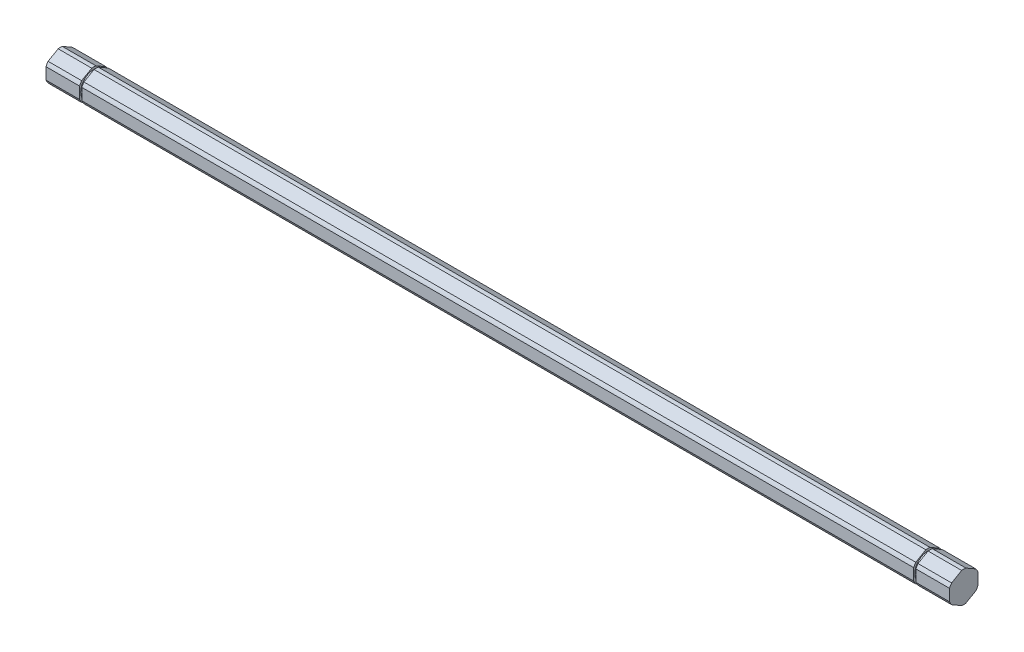
from build123d import *

# Parameters (mm, degrees)
BOSS_EXTRUDE1_DEPTH = 201.58075
SKETCH3_W           = 1.016
SKETCH3_H           = 7.77655802


with BuildPart() as part:
    # Sketch1 → Boss-Extrude1 (new, symmetric)
    with BuildSketch(Plane(origin=(0, 0, 0), x_dir=(0, 0, -1), z_dir=(1, 0, 0))):
        with BuildLine():
            ThreePointArc((0.93173274, 6.79441227), (0, 6.858), (-0.93173274, 6.79441227))
            Line((-0.93173274, 6.79441227), (-5.41826726, 4.204110358))
            ThreePointArc((-5.41826726, 4.204110358), (-5.939202219, 3.429), (-6.35, 2.590301913))
            Line((-6.35, 2.590301913), (-6.35, -2.590301913))
            ThreePointArc((-6.35, -2.590301913), (-5.939202219, -3.429), (-5.41826726, -4.204110358))
            Line((-5.41826726, -4.204110358), (-0.93173274, -6.79441227))
            ThreePointArc((-0.93173274, -6.79441227), (0, -6.858), (0.93173274, -6.79441227))
            Line((0.93173274, -6.79441227), (5.41826726, -4.204110358))
            ThreePointArc((5.41826726, -4.204110358), (5.939202219, -3.429), (6.35, -2.590301913))
            Line((6.35, -2.590301913), (6.35, 2.590301913))
            ThreePointArc((6.35, 2.590301913), (5.939202219, 3.429), (5.41826726, 4.204110358))
            Line((5.41826726, 4.204110358), (0.93173274, 6.79441227))
        make_face()
    extrude(amount=BOSS_EXTRUDE1_DEPTH, both=True)

    # Sketch3 → Cut-Revolve1 (revolve, cut)
    with BuildSketch(Plane(origin=(0, 0, 0), x_dir=(1, 0, 0), z_dir=(0, 1, 0))):
        with Locations((186.08675, -9.73027901)):
            Rectangle(SKETCH3_W, SKETCH3_H)
    cut_revolve1 = revolve(axis=Axis((0, 0, 0), (1, 0, 0)), mode=Mode.SUBTRACT)

    # Mirror1: Cut-Revolve1 across plane
    add(cut_revolve1.mirror(Plane(origin=(0, 0, 0), x_dir=(0, 0, 1), z_dir=(1, 0, 0))), mode=Mode.SUBTRACT)


solid = part.part
